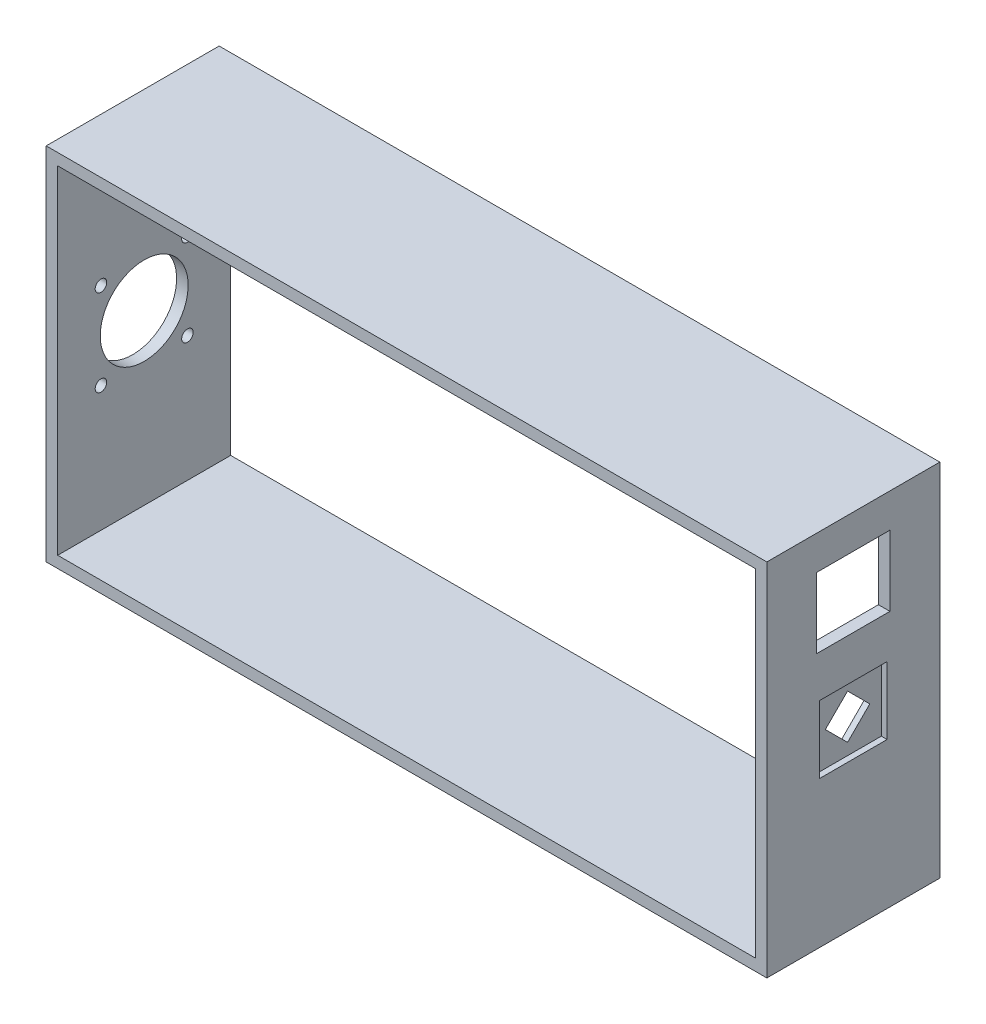
from build123d import *

# Parameters (mm, degrees)
SKIZZE1_W                       = 250
SKIZZE1_H                       = 125
SKIZZE1_W_2                     = 242
SKIZZE1_H_2                     = 117
AUFSATZ_LINEAR_AUSTRAGEN1_DEPTH = 60
SKIZZE2_R                       = 15.25
SKIZZE2_R_2                     = 2
SCHNITT_LINEAR_AUSTRAGEN1_DEPTH = 10
SKIZZE8_W                       = 25.4
SKIZZE8_H                       = 24.4
SCHNITT_LINEAR_AUSTRAGEN6_DEPTH = 22
SKIZZE10_W                      = 23.41492783
SKIZZE10_H                      = 23.41492783
SCHNITT_LINEAR_AUSTRAGEN7_DEPTH = 2


with BuildPart() as part:
    # Skizze1 → Aufsatz-Linear austragen1 (new body)
    with BuildSketch(Plane.XY):
        with Locations((125, 62.5)):
            Rectangle(SKIZZE1_W, SKIZZE1_H)
        with Locations((125, 62.5)):
            Rectangle(SKIZZE1_W_2, SKIZZE1_H_2, mode=Mode.SUBTRACT)
    extrude(amount=AUFSATZ_LINEAR_AUSTRAGEN1_DEPTH)

    # Skizze2 → Schnitt-Linear austragen1 (cut)
    with BuildSketch(Plane.ZY):
        with Locations((30, 62.5)):
            Circle(SKIZZE2_R)
        with Locations((15, 77.5)):
            Circle(SKIZZE2_R_2)
        with Locations((45, 77.5)):
            Circle(SKIZZE2_R_2)
        with Locations((45, 47.5)):
            Circle(SKIZZE2_R_2)
        with Locations((15, 47.5)):
            Circle(SKIZZE2_R_2)
    extrude(amount=-SCHNITT_LINEAR_AUSTRAGEN1_DEPTH, mode=Mode.SUBTRACT)

    # Skizze8 → Schnitt-Linear austragen6 (cut)
    with BuildSketch(Plane(origin=(250, 0, 0), x_dir=(0, 0, -1), z_dir=(1, 0, 0))):
        Polygon((-30, 70.207463915), (-37.707463915, 62.5), (-30, 54.792536085), (-22.292536085, 62.5), align=None)
        with Locations((-30, 101)):
            Rectangle(SKIZZE8_W, SKIZZE8_H)
    extrude(amount=-SCHNITT_LINEAR_AUSTRAGEN6_DEPTH, mode=Mode.SUBTRACT)

    # Skizze10 → Schnitt-Linear austragen7 (cut)
    with BuildSketch(Plane(origin=(250, 0, 0), x_dir=(0, 0, -1), z_dir=(1, 0, 0))):
        with Locations((-30, 62.5)):
            Rectangle(SKIZZE10_W, SKIZZE10_H)
    extrude(amount=-SCHNITT_LINEAR_AUSTRAGEN7_DEPTH, mode=Mode.SUBTRACT)


solid = part.part
